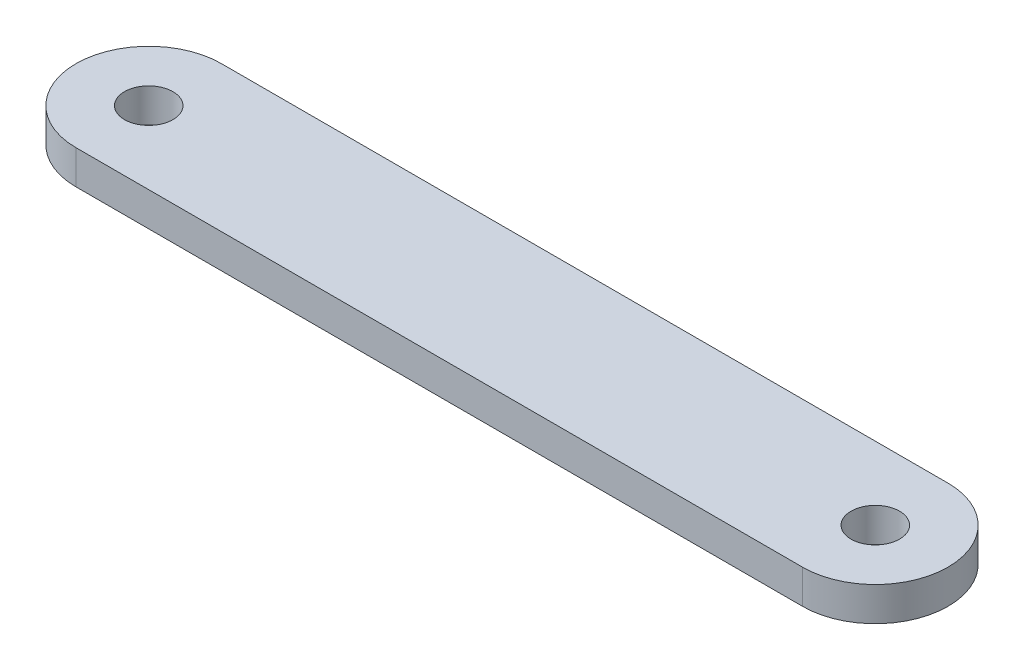
from build123d import *

# Parameters (mm, degrees)
SKETCH_1_R      = 5
EXTRUDE_1_DEPTH = 7


with BuildPart() as part:
    # Эскиз1 → Вытянуть1 (new body)
    with BuildSketch(Plane(origin=(0, 0, 0), x_dir=(1, 0, 0), z_dir=(0, 1, 0))):
        with BuildLine():
            Line((0, 15), (149.801569261, 15))
            ThreePointArc((149.801569261, 15), (164.801569261, 0), (149.801569261, -15))
            Line((149.801569261, -15), (0, -15))
            ThreePointArc((0, -15), (-15, 0), (0, 15))
        make_face()
        Circle(SKETCH_1_R, mode=Mode.SUBTRACT)
        with Locations((149.801569261, 0)):
            Circle(SKETCH_1_R, mode=Mode.SUBTRACT)
    extrude(amount=EXTRUDE_1_DEPTH)


solid = part.part
